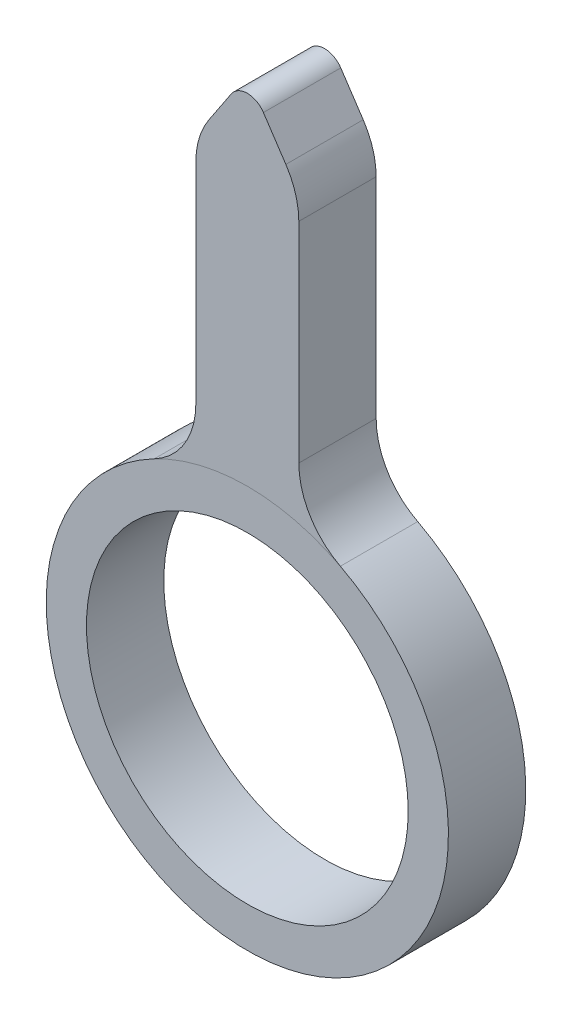
from build123d import *

# Parameters (mm, degrees)
SKETCH1_R           = 3.302
BOSS_EXTRUDE1_DEPTH = 1.5875
FILLET1_R           = 1.5875
FILLET2_R           = 0.396875
FILLET3_R           = 1.5875


with BuildPart() as part:
    # Sketch1 → Boss-Extrude1 (new body)
    with BuildSketch(Plane.XY):
        with BuildLine():
            Line((1.05664, 3.989958416), (1.05664, 9.8425))
            Line((1.05664, 9.8425), (0, 11.43))
            Line((0, 11.43), (-1.05664, 9.8425))
            Line((-1.05664, 9.8425), (-1.05664, 3.989958416))
            ThreePointArc((-1.05664, 3.989958416), (0, -4.1275), (1.05664, 3.989958416))
        make_face()
        Circle(SKETCH1_R, mode=Mode.SUBTRACT)
    extrude(amount=BOSS_EXTRUDE1_DEPTH)

    # Fillet1
    fillet1_edges = [part.edges().sort_by_distance(p)[0] for p in [
        (1.05664, 9.8425, 0.79375),
        (-1.05664, 9.8425, 0.79375),
    ]]
    fillet(fillet1_edges, radius=FILLET1_R)

    # Fillet2
    fillet2_edges = [part.edges().sort_by_distance(p)[0] for p in [
        (0, 11.43, 0.79375),
    ]]
    fillet(fillet2_edges, radius=FILLET2_R)

    # Fillet3
    fillet3_edges = [part.edges().sort_by_distance(p)[0] for p in [
        (-1.05664, 3.989958416, 0.79375),
        (1.05664, 3.989958416, 0.79375),
    ]]
    fillet(fillet3_edges, radius=FILLET3_R)


solid = part.part
